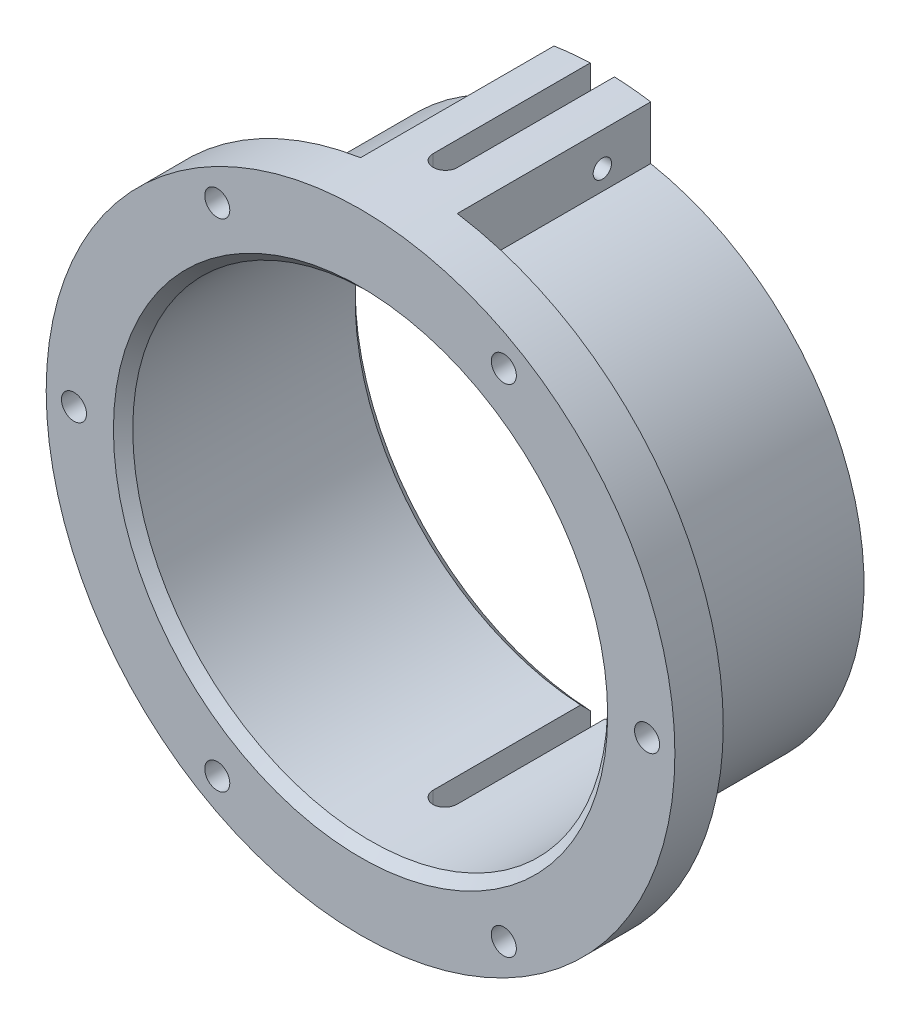
from build123d import *
from build123d.topology import SkipClean

# Parameters (mm, degrees)
BOSS_EXTRUDE1_DEPTH        = 40
SKETCH3_W                  = 5
SKETCH3_H                  = 136
CUT_EXTRUDE1_DEPTH         = 35
FILLET1_R                  = 2.5
CHAMFER1_SIZE              = 2
CHAMFER2_SIZE              = 2
F_6_0_204_DIAMETER_HOLE1_D = 5.1816
CIRPATTERN1_COUNT          = 6
LPATTERN1_COUNT            = 2
LPATTERN1_PITCH            = 116.5


with BuildPart() as part:
    # Sketch1 → Revolve1 (revolve)
    with BuildSketch(Plane(origin=(0, 0, 0), x_dir=(0, 0, -1), z_dir=(1, 0, 0)), mode=Mode.PRIVATE) as revolve1_sk:
        Polygon((5, 49.1), (55, 49.1), (55, 54.1), (15, 54.1), (15, 65), (5, 65), align=None)
    revolve(revolve1_sk.sketch.rotate(Axis((0, 0, 0), (0, 0, -1)), 90), axis=Axis((0, 0, 0), (0, 0, -1)))

    # Sketch2 → Boss-Extrude1 (add)
    with BuildSketch(Plane(origin=(0, 0, -15), x_dir=(-1, 0, 0), z_dir=(0, 0, -1))):
        with BuildLine():
            Line((-10, 64.226162893), (-10, 53.167753385))
            ThreePointArc((-10, 53.167753385), (0, 54.1), (10, 53.167753385))
            Line((10, 53.167753385), (10, 64.226162893))
            ThreePointArc((10, 64.226162893), (0, 65), (-10, 64.226162893))
        make_face()
    boss_extrude1 = extrude(amount=BOSS_EXTRUDE1_DEPTH)

    # Mirror1: Boss-Extrude1 across plane
    with SkipClean():  # the faces are left unmerged after this step: merging them gives an invalid solid
        add(boss_extrude1.mirror(Plane.ZX))

    # Sketch3 → Cut-Extrude1 (cut)
    with BuildSketch(Plane(origin=(0, 0, -55), x_dir=(-1, 0, 0), z_dir=(0, 0, -1))):
        with Locations((0, -0.177278441)):
            Rectangle(SKETCH3_W, SKETCH3_H)
    extrude(amount=-CUT_EXTRUDE1_DEPTH, mode=Mode.SUBTRACT)

    # Fillet1
    # the kernel refuses this fillet: 2.5 mm, written as the material it adds along each edge
    with BuildSketch(Plane(origin=(2.5, -71.201905284, -20), x_dir=(-1, 0, 0), z_dir=(0, 1, 0))) as fillet1_piece_1_section:
        with BuildLine():
            CenterArc((FILLET1_R, -FILLET1_R), FILLET1_R, 90, 90)
            Line((0, -FILLET1_R), (0, 0))
            Line((0, 0), (FILLET1_R, 0))
        make_face()
    fillet1_piece_1 = extrude(amount=28.415592209, mode=Mode.PRIVATE)
    fillet1_piece_1 = fillet1_piece_1 - Plane(origin=(0, 0, -20.566080782), x_dir=(1, 0, 0), z_dir=(0, 0, -1)) * Cylinder(49.1, 67, mode=Mode.PRIVATE)
    fillet1_piece_1 = fillet1_piece_1 & Plane(origin=(0, 0, -20.566080782), x_dir=(-0.15384615384615422, -0.9880948137434714, 0), z_dir=(0, 0, 1)) * Cylinder(65, 67, mode=Mode.PRIVATE)
    with BuildSketch(Plane(origin=(2.5, 42.786313075, -20), x_dir=(0, 0, -1), z_dir=(0, 1, 0))) as fillet1_piece_2_section:
        with BuildLine():
            CenterArc((FILLET1_R, FILLET1_R), FILLET1_R, 180, 90)
            Line((0, FILLET1_R), (0, 0))
            Line((0, 0), (FILLET1_R, 0))
        make_face()
    fillet1_piece_2 = extrude(amount=28.415592209, mode=Mode.PRIVATE)
    fillet1_piece_2 = fillet1_piece_2 - Plane(origin=(0, 0, -20.566075474), x_dir=(1, 0, 0), z_dir=(0, 0, -1)) * Cylinder(49.1, 67, mode=Mode.PRIVATE)
    fillet1_piece_2 = fillet1_piece_2 & Plane(origin=(0, 0, -20.566075474), x_dir=(1, 0, 0), z_dir=(0, 0, 1)) * Cylinder(65, 67, mode=Mode.PRIVATE)
    with BuildSketch(Plane(origin=(-2.5, -42.786313075, -20), x_dir=(0, 0, -1), z_dir=(0, -1, 0))) as fillet1_piece_3_section:
        with BuildLine():
            CenterArc((FILLET1_R, FILLET1_R), FILLET1_R, 180, 90)
            Line((0, FILLET1_R), (0, 0))
            Line((0, 0), (FILLET1_R, 0))
        make_face()
    fillet1_piece_3 = extrude(amount=28.415592209, mode=Mode.PRIVATE)
    fillet1_piece_3 = fillet1_piece_3 - Plane(origin=(0, 0, -20.566082494), x_dir=(1, 0, 0), z_dir=(0, 0, -1)) * Cylinder(49.1, 67, mode=Mode.PRIVATE)
    fillet1_piece_3 = fillet1_piece_3 & Plane(origin=(0, 0, -20.566082494), x_dir=(-0.15384615384615422, -0.9880948137434714, 0), z_dir=(0, 0, 1)) * Cylinder(65, 67, mode=Mode.PRIVATE)
    with BuildSketch(Plane(origin=(-2.5, 71.201905284, -20), x_dir=(1, 0, 0), z_dir=(0, -1, 0))) as fillet1_piece_4_section:
        with BuildLine():
            CenterArc((FILLET1_R, -FILLET1_R), FILLET1_R, 90, 90)
            Line((0, -FILLET1_R), (0, 0))
            Line((0, 0), (FILLET1_R, 0))
        make_face()
    fillet1_piece_4 = extrude(amount=28.415592209, mode=Mode.PRIVATE)
    fillet1_piece_4 = fillet1_piece_4 - Plane(origin=(0, 0, -20.566085883), x_dir=(1, 0, 0), z_dir=(0, 0, -1)) * Cylinder(49.1, 67, mode=Mode.PRIVATE)
    fillet1_piece_4 = fillet1_piece_4 & Plane(origin=(0, 0, -20.566085883), x_dir=(1, 0, 0), z_dir=(0, 0, 1)) * Cylinder(65, 67, mode=Mode.PRIVATE)
    add([fillet1_piece_1, fillet1_piece_2, fillet1_piece_3, fillet1_piece_4])

    # Chamfer1
    chamfer1_edges = [part.edges().sort_by_distance(p)[0] for p in [
        (-49.1, 0, -55),
        (35.591853, -33.823512532, -55),
    ]]
    chamfer(chamfer1_edges, length=CHAMFER1_SIZE)

    # Chamfer2
    chamfer2_edges = [part.edges().sort_by_distance(p)[0] for p in [
        (-49.1, 0, -5),
    ]]
    chamfer(chamfer2_edges, length=CHAMFER2_SIZE)

    # #6 (0.204) Diameter Hole1 (through all)
    with Locations(Plane.XY.offset(-5)):
        with Locations((-29.625, 51.312005174)):
            f_6_0_204_diameter_hole1 = Hole(F_6_0_204_DIAMETER_HOLE1_D / 2)

    # CirPattern1: #6 (0.204) Diameter Hole1 ×6 about axis
    with SkipClean():  # the faces are left unmerged after this step: merging them gives an invalid solid
        cirpattern1_axis = Axis((0, 0, 0), (0, 0, 1))
        for i in range(1, CIRPATTERN1_COUNT):
            add(f_6_0_204_diameter_hole1.rotate(cirpattern1_axis, i * 360 / CIRPATTERN1_COUNT), mode=Mode.SUBTRACT)

    # Sketch8 → CBORE for #6 Binding Head Machine Screw1 (revolve, cut)
    with SkipClean():  # the faces are left unmerged after this step: merging them gives an invalid solid
        with BuildSketch(Plane(origin=(-10, -59.226162893, -45), x_dir=(0, 0, 1), z_dir=(0, 1, 0))):
            Polygon((0, 0), (0, 26.140824014), (1.89865, 25), (1.89865, 2.2098), (3.96875, 2.2098), (3.96875, 0), align=None)
        cbore_for_6_binding_head_machine_screw1 = revolve(axis=Axis((-16.35, -59.226162893, -45), (1, 0, 0)), mode=Mode.SUBTRACT)

    # LPattern1: CBORE for #6 Binding Head Machine Screw1 ×2
    with SkipClean():  # the faces are left unmerged after this step: merging them gives an invalid solid
        with Locations(*[(0, i * LPATTERN1_PITCH, 0) for i in range(1, LPATTERN1_COUNT)]):
            add(cbore_for_6_binding_head_machine_screw1, mode=Mode.SUBTRACT)


solid = part.part
